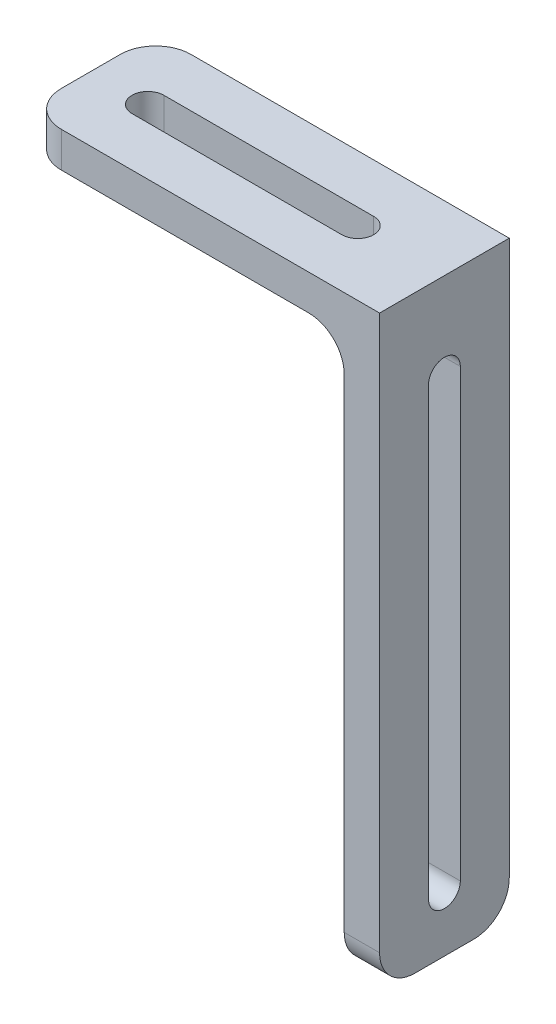
from build123d import *

# Parameters (mm, degrees)
BOSS_EXTRUDE1_DEPTH = 11
CUT_EXTRUDE1_DEPTH  = 60.338014797
CUT_EXTRUDE2_DEPTH  = 58.879184514
FILLET1_R           = 3
FILLET2_R           = 3


with BuildPart() as part:
    # Sketch1 → Boss-Extrude1 (new body)
    with BuildSketch(Plane.XY):
        Polygon((0, 0), (3, 0), (3, 50), (-27, 50), (-27, 47), (0, 47), align=None)
    extrude(amount=BOSS_EXTRUDE1_DEPTH)

    # Sketch6 → Cut-Extrude1 (cut, through all)
    with BuildSketch(Plane(origin=(3, 0, 0), x_dir=(0, 0, -1), z_dir=(1, 0, 0))):
        with BuildLine():
            Line((-4.15, 42.65), (-4.15, 4.85))
            ThreePointArc((-4.15, 4.85), (-5.5, 3.5), (-6.85, 4.85))
            Line((-6.85, 4.85), (-6.85, 42.65))
            ThreePointArc((-6.85, 42.65), (-5.5, 44), (-4.15, 42.65))
        make_face()
    extrude(amount=-CUT_EXTRUDE1_DEPTH, mode=Mode.SUBTRACT)

    # Sketch7 → Cut-Extrude2 (cut, through all)
    with BuildSketch(Plane(origin=(0, 50, 0), x_dir=(1, 0, 0), z_dir=(0, 1, 0))):
        with BuildLine():
            Line((-22.15, -4.15), (-4.35, -4.15))
            ThreePointArc((-4.35, -4.15), (-3, -5.5), (-4.35, -6.85))
            Line((-4.35, -6.85), (-22.15, -6.85))
            ThreePointArc((-22.15, -6.85), (-23.5, -5.5), (-22.15, -4.15))
        make_face()
    extrude(amount=-CUT_EXTRUDE2_DEPTH, mode=Mode.SUBTRACT)

    # Fillet1
    fillet1_edges = [part.edges().sort_by_distance(p)[0] for p in [
        (0, 47, 5.5),
    ]]
    fillet(fillet1_edges, radius=FILLET1_R - 0.0001)  # a hair under: the kernel refuses the full size

    # Fillet2
    fillet2_edges = [part.edges().sort_by_distance(p)[0] for p in [
        (-27, 48.5, 11),
        (-27, 48.5, 0),
        (1.5, 0, 0),
        (1.5, 0, 11),
    ]]
    fillet(fillet2_edges, radius=FILLET2_R)


solid = part.part
